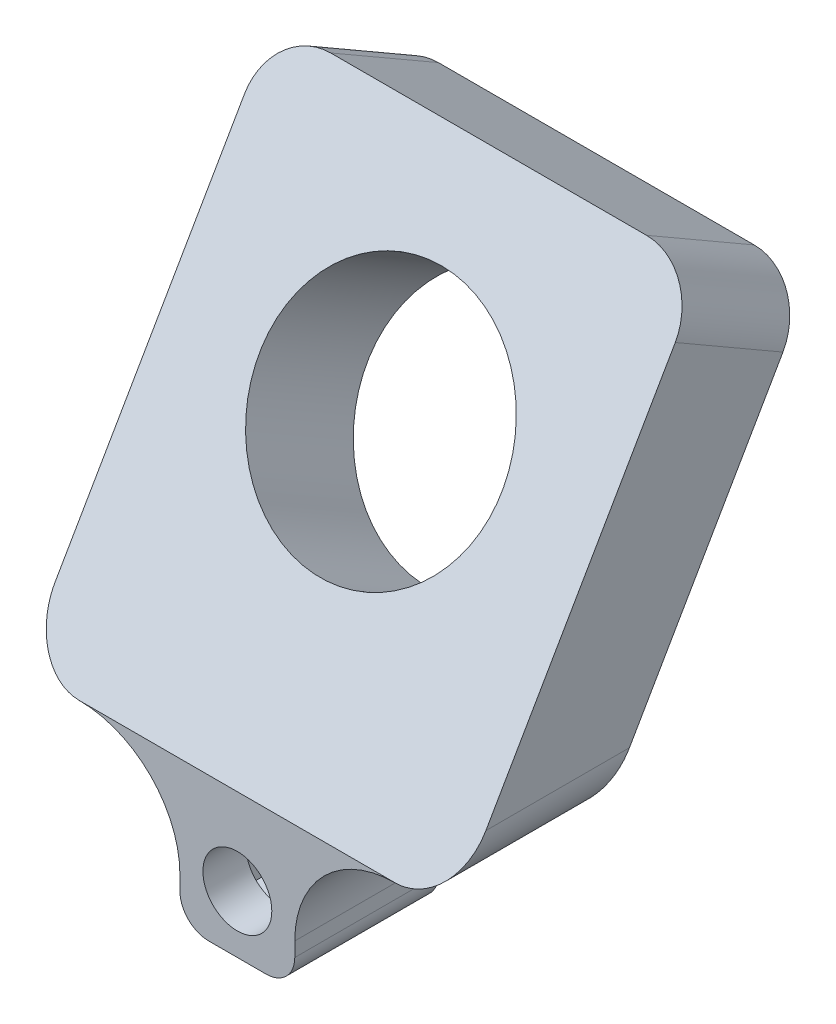
from build123d import *

# Parameters (mm, degrees)
SKETCH1_W                = 4
SKETCH1_H                = 5
BOSS_EXTRUDE1_DEPTH      = 2.5
SKETCH2_W                = 3
SKETCH2_H                = 3
CUT_EXTRUDE1_DEPTH       = 3.5
BOSS_EXTRUDE2_DEPTH      = 7.5
F_5_16_CLEARANCE_HOLE1_D = 8.4328
M2_CLEARANCE_HOLE1_D     = 2.4
FILLET1_R                = 3.5
FILLET2_R                = 2
FILLET3_R                = 1


with BuildPart() as part:
    # Sketch1 → Boss-Extrude1 (new, symmetric)
    with BuildSketch(Plane.XY):
        Rectangle(SKETCH1_W, SKETCH1_H)
    extrude(amount=BOSS_EXTRUDE1_DEPTH, both=True)

    # Sketch2 → Cut-Extrude1 (cut)
    with BuildSketch(Plane(origin=(0, 0, -2.5), x_dir=(-1, 0, 0), z_dir=(0, 0, -1))):
        with Locations((0, -0.5)):
            Rectangle(SKETCH2_W, SKETCH2_H)
    extrude(amount=-CUT_EXTRUDE1_DEPTH, mode=Mode.SUBTRACT)

    # Sketch3 → Boss-Extrude2 (add, symmetric)
    with BuildSketch(Plane(origin=(0, 0, 0), x_dir=(0, 0, -1), z_dir=(1, 0, 0))):
        Polygon((-2.5, 2.5), (6.25, 17.655444566), (10, 15.490381057), (2.5, 2.5), align=None)
    extrude(amount=BOSS_EXTRUDE2_DEPTH, both=True)

    # 5/16 Clearance Hole1 (through all)
    with Locations(Plane(origin=(0, -0.457531755, -0.792468245), x_dir=(-1, 0, 0), z_dir=(0, -0.5000000000000038, -0.8660254037844366))):
        with Locations((0, 10.915063509)):
            Hole(F_5_16_CLEARANCE_HOLE1_D / 2)

    # M2 Clearance Hole1 (through all)
    with Locations(Plane.XY.offset(2.5)):
        with Locations((0, -0.5)):
            Hole(M2_CLEARANCE_HOLE1_D / 2)

    # Fillet1
    fillet1_edges = [part.edges().sort_by_distance(p)[0] for p in [
        (-2, 2.5, 0),
        (2, 2.5, 0),
    ]]
    fillet(fillet1_edges, radius=FILLET1_R)

    # Fillet2
    fillet2_edges = [part.edges().sort_by_distance(p)[0] for p in [
        (-7.5, 16.572912811, -8.125),
        (7.5, 16.572912811, -8.125),
        (7.5, 2.5, 0),
        (-7.5, 2.5, 0),
    ]]
    fillet(fillet2_edges, radius=FILLET2_R - 0.0001)  # a hair under: the kernel refuses the full size

    # Fillet3
    fillet3_edges = [part.edges().sort_by_distance(p)[0] for p in [
        (2, -2.5, 0),
        (-2, -2.5, 0),
    ]]
    fillet(fillet3_edges, radius=FILLET3_R)


solid = part.part
